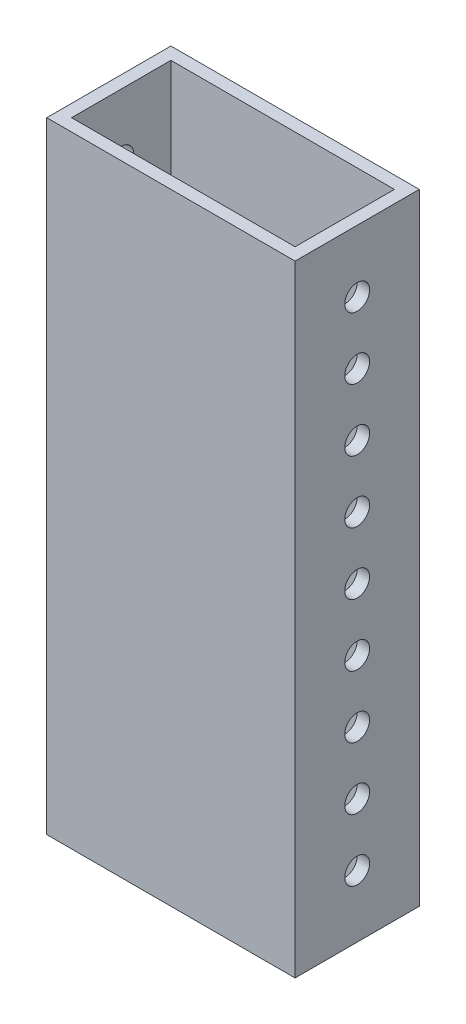
from build123d import *

# Parameters (mm, degrees)
SKETCH1_W           = 50.8
SKETCH1_H           = 25.4
SKETCH1_W_2         = 45.72
SKETCH1_H_2         = 20.32
BOSS_EXTRUDE2_DEPTH = 127
SKETCH2_R           = 2.54
CUT_EXTRUDE1_DEPTH  = 127


with BuildPart() as part:
    # Sketch1 → Boss-Extrude2 (new body)
    with BuildSketch(Plane(origin=(0, 0, 0), x_dir=(1, 0, 0), z_dir=(0, 1, 0))):
        with Locations((-34.550728477, 5.021125828)):
            Rectangle(SKETCH1_W, SKETCH1_H)
        with Locations((-34.550728477, 5.021125828)):
            Rectangle(SKETCH1_W_2, SKETCH1_H_2, mode=Mode.SUBTRACT)
    extrude(amount=BOSS_EXTRUDE2_DEPTH)

    # Sketch2 → Cut-Extrude1 (cut)
    with BuildSketch(Plane(origin=(-9.150728477, 0, 0), x_dir=(0, 0, -1), z_dir=(1, 0, 0))):
        with Locations((5.021125828, 114.3)):
            Circle(SKETCH2_R)
        with Locations((5.021125828, 101.6)):
            Circle(SKETCH2_R)
        with Locations((5.021125828, 88.9)):
            Circle(SKETCH2_R)
        with Locations((5.021125828, 76.2)):
            Circle(SKETCH2_R)
        with Locations((5.021125828, 63.5)):
            Circle(SKETCH2_R)
        with Locations((5.021125828, 50.8)):
            Circle(SKETCH2_R)
        with Locations((5.021125828, 38.1)):
            Circle(SKETCH2_R)
        with Locations((5.021125828, 25.4)):
            Circle(SKETCH2_R)
        with Locations((5.021125828, 12.7)):
            Circle(SKETCH2_R)
    extrude(amount=-CUT_EXTRUDE1_DEPTH, mode=Mode.SUBTRACT)


solid = part.part
